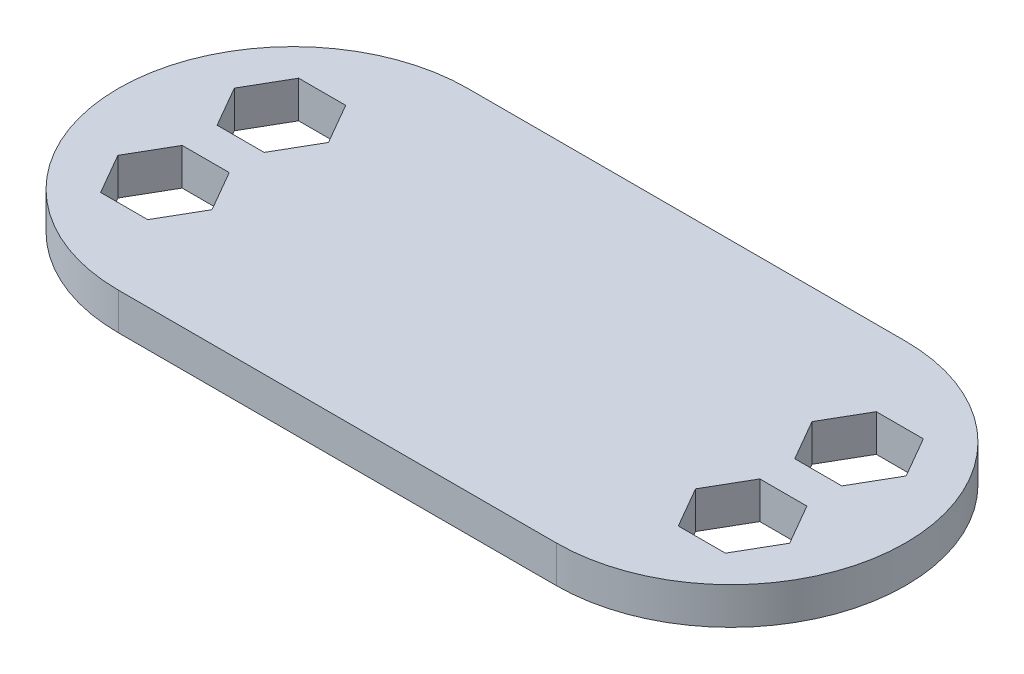
from build123d import *

# Parameters (mm, degrees)
BOSS_EXTRUDE1_DEPTH = 3.175


with BuildPart() as part:
    # Sketch2 → Boss-Extrude1 (new body)
    with BuildSketch(Plane(origin=(0, 0, 0), x_dir=(1, 0, 0), z_dir=(0, 1, 0))):
        with BuildLine():
            Line((-145.521414695, 0.997059393), (-107.921414695, 0.997059393))
            ThreePointArc((-107.921414695, 0.997059393), (-92.921414695, -14.002940607), (-107.921414695, -29.002940607))
            Line((-107.921414695, -29.002940607), (-145.521414695, -29.002940607))
            ThreePointArc((-145.521414695, -29.002940607), (-160.521414695, -14.002940607), (-145.521414695, 0.997059393))
        make_face()
        Polygon((-149.500688753, -12.502940607), (-147.479962811, -9.002940607), (-149.500688753, -5.502940607), (-153.542140637, -5.502940607), (-155.562866579, -9.002940607), (-153.542140637, -12.502940607), align=None, mode=Mode.SUBTRACT)
        Polygon((-153.542140637, -15.502940607), (-149.500688753, -15.502940607), (-147.479962811, -19.002940607), (-149.500688753, -22.502940607), (-153.542140637, -22.502940607), (-155.562866579, -19.002940607), align=None, mode=Mode.SUBTRACT)
        Polygon((-103.942140637, -15.502940607), (-105.962866579, -19.002940607), (-103.942140637, -22.502940607), (-99.900688753, -22.502940607), (-97.879962811, -19.002940607), (-99.900688753, -15.502940607), align=None, mode=Mode.SUBTRACT)
        Polygon((-99.900688753, -12.502940607), (-103.942140637, -12.502940607), (-105.962866579, -9.002940607), (-103.942140637, -5.502940607), (-99.900688753, -5.502940607), (-97.879962811, -9.002940607), align=None, mode=Mode.SUBTRACT)
    extrude(amount=BOSS_EXTRUDE1_DEPTH)


solid = part.part
